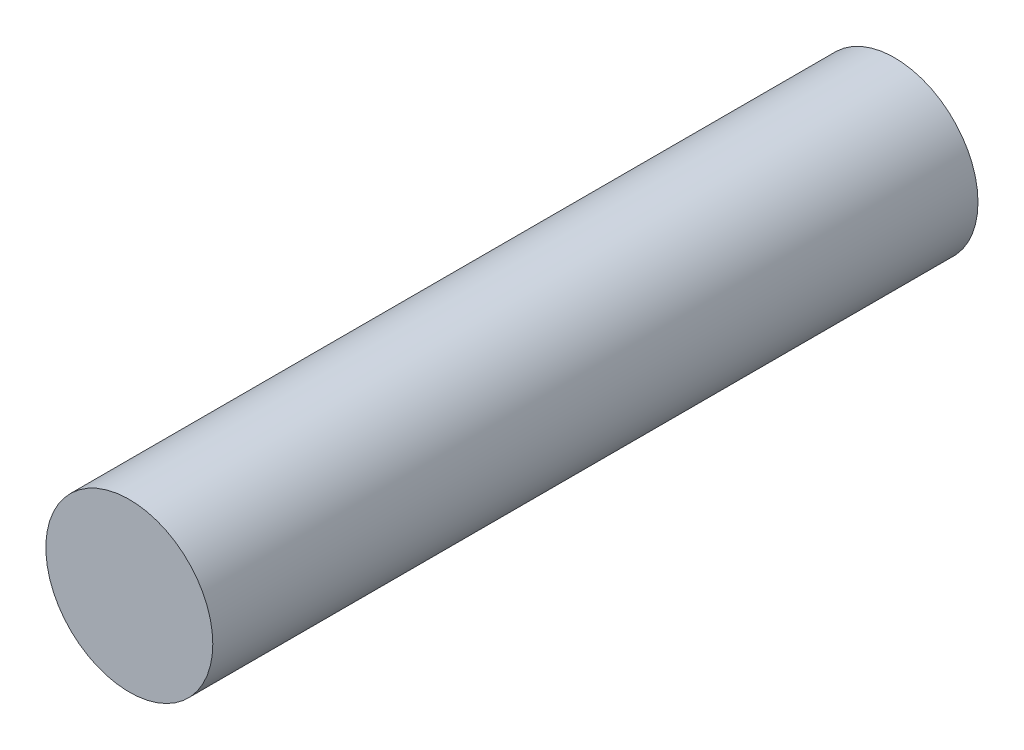
from build123d import *

# Parameters (mm, degrees)
SZKIC1_R                    = 6
DODANIE_WYCI_GNI_CIE1_DEPTH = 55


with BuildPart() as part:
    # Szkic1 → Dodanie-wyciągnięcie1 (new body)
    with BuildSketch(Plane.XY):
        Circle(SZKIC1_R)
    extrude(amount=DODANIE_WYCI_GNI_CIE1_DEPTH)


solid = part.part
